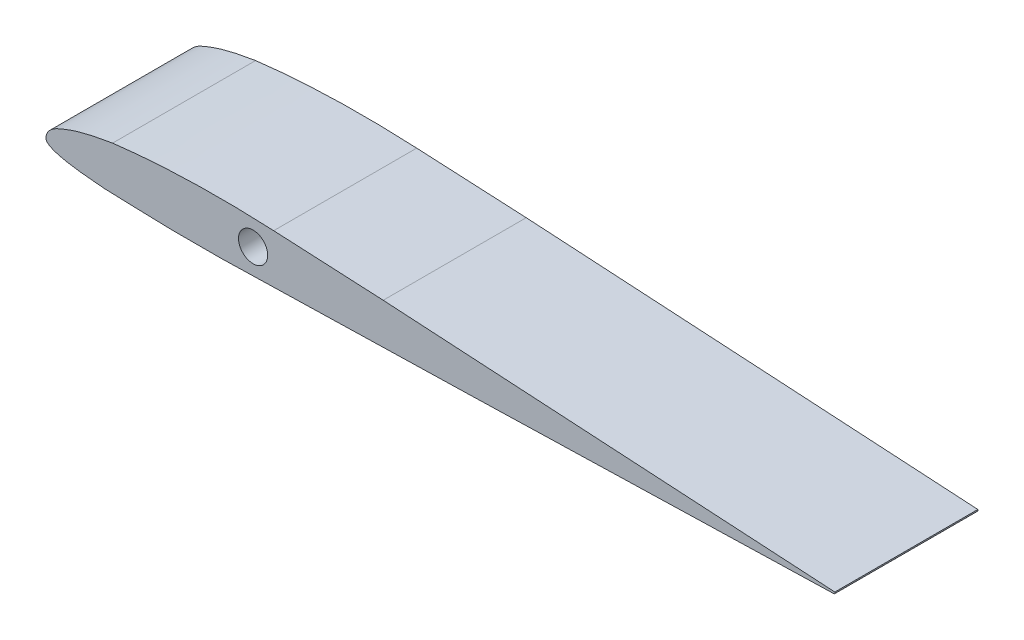
from build123d import *

# Parameters (mm, degrees)
AIRFOIL_DEPTH        = 36.83
CAMERA_CHANNEL_REACH = 209.281
SKETCH8_R            = 3.7592


with BuildPart() as part:
    # Sketch3 → Airfoil (new body)
    with BuildSketch(Plane.XY):
        with BuildLine():
            Line((202.994130812, 8.658655976), (110.583708873, 6.155294174))
            Line((110.583708873, 6.155294174), (45.243748526, 4.547671469))
            add(Edge.make_bspline(
                [(45.243748526, 4.547671469), (38.923572392, 4.568921268), (32.598685078, 4.437436548), (26.283676376, 4.693840567), (22.348358646, 4.853623607), (18.410196386, 4.937297779), (14.474878656, 5.097080819), (14.412947754, 5.099595357), (14.370093626, 5.173356562), (14.308475425, 5.180061537), (13.757234945, 5.240044692), (0.092319138, 5.933082267), (0.001596992, 8.740633601), (-0.083348667, 11.369421688), (3.240638559, 12.597933624), (5.152498304, 13.319770824), (6.702595853, 13.905021952), (8.281848193, 14.426252138), (9.890881707, 14.821641117), (12.262560893, 15.404435574), (14.691150833, 15.883501489), (17.149620686, 16.274957356)],
                knots=[0, 0, 0, 0, 1, 1, 1, 2, 2, 2, 3, 3, 3, 4, 4, 4, 5, 5, 5, 6, 6, 6, 6.272168289, 6.272168289, 6.272168289, 6.272168289], degree=3))
            add(Edge.make_bspline(
                [(17.149620686, 16.274957356), (28.832499255, 17.725653279), (42.670326445, 18.291936138), (58.641329464, 17.491030382)],
                knots=[0, 0, 0, 0, 1, 1, 1, 1], degree=3))
            Line((58.641329464, 17.491030382), (86.846468464, 16.076613382))
            Line((86.846468464, 16.076613382), (160.978559464, 11.666960382))
            Line((160.978559464, 11.666960382), (203.160688074, 9.157810196))
            ThreePointArc((203.160688074, 9.157810196), (203.180787666, 8.873737948), (202.994130812, 8.658655976))
        make_face()
    extrude(amount=AIRFOIL_DEPTH)

    # Sketch8 → Camera Channel (cut, up to next)
    with BuildSketch(Plane(origin=(0, 0, 0), x_dir=(-1, 0, 0), z_dir=(0, 0, -1)), mode=Mode.PRIVATE) as camera_channel_sk1:
        with Locations((-53.34, 11.228365492)):
            Circle(SKETCH8_R)
    camera_channel_tool1 = extrude(camera_channel_sk1.sketch, amount=-CAMERA_CHANNEL_REACH, mode=Mode.PRIVATE) & part.part
    add(camera_channel_tool1.solids().sort_by_distance((53.34, 11.228365, 0))[0], mode=Mode.SUBTRACT)


solid = part.part
